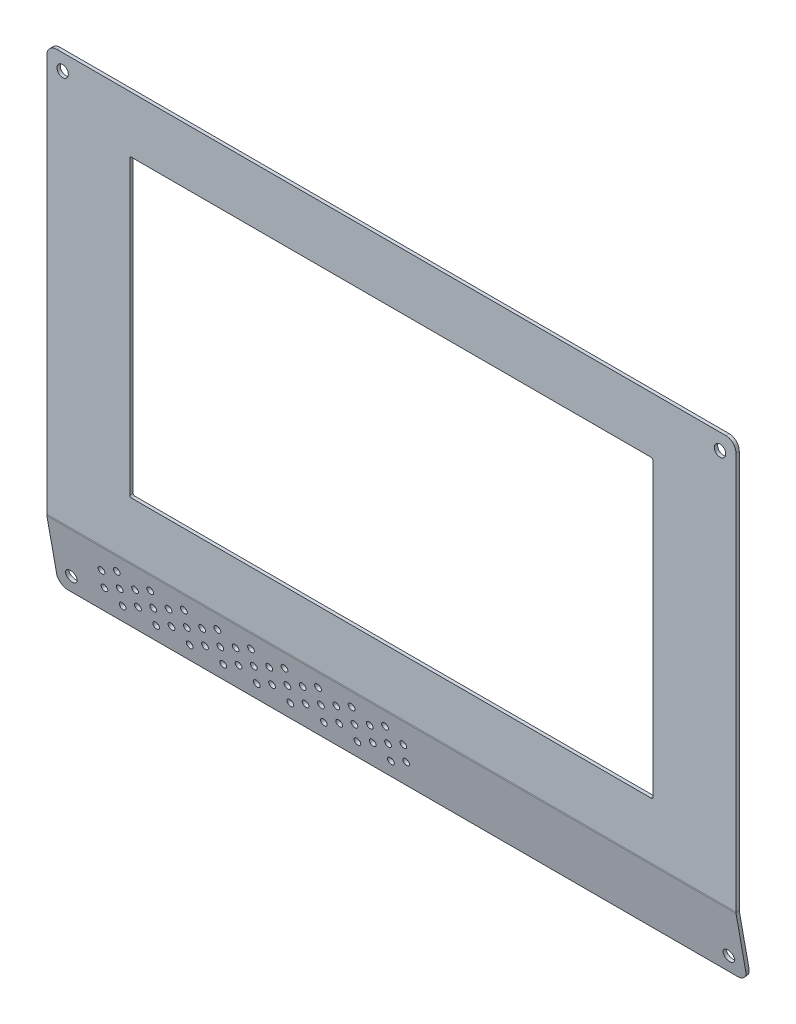
from build123d import *

# Parameters (mm, degrees)
SKETCH_2_W                      = 205.5
SKETCH_2_H                      = 121.5
SM_BASE_FLANGE_1_DEPTH          = 1
SM_EDGE_FLANGE_1_DEPTH          = 205.5
FILLET_1_R                      = 3
SKETCH_12_W                     = 156
SKETCH_12_H                     = 88
CUT_EXTRUDE_2_DEPTH             = 10
FILLET_2_R                      = 0.5
HOLE_WIZARD_M31_D               = 3.4
HOLE_WIZARD_M31_DEPTH           = 8.5
HOLE_WIZARD_M31_TIP             = 1.021463052
HOLE_WIZARD_M31_ON_FACE_2_D     = 3.4
HOLE_WIZARD_M31_ON_FACE_2_DEPTH = 8.5
HOLE_WIZARD_M31_ON_FACE_2_TIP   = 1.021463052
HOLE_WIZARD_M31_ON_FACE_3_D     = 3.4
HOLE_WIZARD_M31_ON_FACE_3_DEPTH = 8.5
HOLE_WIZARD_M31_ON_FACE_3_TIP   = 1.021463052
SKETCH_16_R                     = 1
CUT_EXTRUDE_3_DEPTH             = 10
PATTERN_LINEAR_1_COUNT          = 5
PATTERN_LINEAR_1_PITCH          = 10
PATTERN_LINEAR_1_COL_COUNT      = 5
PATTERN_LINEAR_1_COL_PITCH      = 10
SKETCH_17_R                     = 1
CUT_EXTRUDE_4_DEPTH             = 1
PATTERN_LINEAR_2_COUNT          = 6
PATTERN_LINEAR_2_PITCH          = 10
PATTERN_LINEAR_2_COL_COUNT      = 5
PATTERN_LINEAR_2_COL_PITCH      = 10


# Sheet-metal steps are written as plain solids
with BuildPart() as part:
    # Sketch 2 → Базовая кромка1 (new body)
    with BuildSketch(Plane.XY):
        Rectangle(SKETCH_2_W, SKETCH_2_H)
    extrude(amount=-SM_BASE_FLANGE_1_DEPTH)

    # Ребро-кромка1 section (across the edge) → Ребро-кромка1 (add)
    with BuildSketch(Plane(origin=(102.75, -60.889981862, -1), x_dir=(0, 0.1736481776669237, -0.9848077530122092), z_dir=(-1, 0, 0))):
        with BuildLine():
            Line((-1, 0.139981862), (-1, 19.912511336))
            Line((-1, 19.912511336), (0, 19.912511336))
            Line((0, 19.912511336), (0, 0.139981862))
            ThreePointArc((0, 0.139981862), (0.006088483, 0.000532673), (0.024307595, -0.137855223))
            Line((0.024307595, -0.137855223), (-0.960500158, -0.3115034))
            ThreePointArc((-0.960500158, -0.3115034), (-0.990106215, -0.08662307), (-1, 0.139981862))
        make_face()
    extrude(amount=SM_EDGE_FLANGE_1_DEPTH)

    # Скругление1
    fillet_1_edges = [part.edges().sort_by_distance(p)[0] for p in [
        (102.75, -80.586801497, -3.96536743),
        (-102.75, -80.586801497, -3.96536743),
        (-102.75, 60.75, -0.5),
        (102.75, 60.75, -0.5),
    ]]
    fillet(fillet_1_edges, radius=FILLET_1_R)

    # Эскиз12 → Вырез-Вытянуть2 (cut)
    with BuildSketch(Plane.XY):
        Rectangle(SKETCH_12_W, SKETCH_12_H)
    extrude(amount=-CUT_EXTRUDE_2_DEPTH, mode=Mode.SUBTRACT)

    # Скругление2
    fillet_2_edges = [part.edges().sort_by_distance(p)[0] for p in [
        (-78, -44, -0.5),
        (-78, 44, -0.5),
        (78, 44, -0.5),
        (78, -44, -0.5),
    ]]
    fillet(fillet_2_edges, radius=FILLET_2_R)

    # Сверло под метчик  спиральное M31
    with Locations(Plane(origin=(-98.021320344, -75.77058326, -2.608424904), x_dir=(0, 0.984807753012, 0.173648177667), z_dir=(0, -0.173648177667, 0.984807753012))):
        with Locations((0, 0)):
            Hole(HOLE_WIZARD_M31_D / 2, depth=HOLE_WIZARD_M31_DEPTH)
            with Locations((0, 0, -(HOLE_WIZARD_M31_DEPTH + HOLE_WIZARD_M31_TIP / 2))):  # 118° drill point
                Cone(0, HOLE_WIZARD_M31_D / 2, HOLE_WIZARD_M31_TIP, mode=Mode.SUBTRACT)

    # Сверло под метчик  спиральное M31 on face 2
    with Locations(Plane(origin=(98.021320344, -75.77058326, -2.608424904), x_dir=(0, 0.984807790843, 0.17364796312), z_dir=(0, -0.17364796312, 0.984807790843))):
        with Locations((0, 0)):
            Hole(HOLE_WIZARD_M31_ON_FACE_2_D / 2, depth=HOLE_WIZARD_M31_ON_FACE_2_DEPTH)
            with Locations((0, 0, -(HOLE_WIZARD_M31_ON_FACE_2_DEPTH + HOLE_WIZARD_M31_ON_FACE_2_TIP / 2))):  # 118° drill point
                Cone(0, HOLE_WIZARD_M31_ON_FACE_2_D / 2, HOLE_WIZARD_M31_ON_FACE_2_TIP, mode=Mode.SUBTRACT)

    # Сверло под метчик  спиральное M31 on face 3
    with Locations(Plane(origin=(-98.021320344, 55.994949149, 0), x_dir=(1, 0, 0), z_dir=(0, 0, 1))):
        with Locations((0, 0), (196.042640688, 0)):
            Hole(HOLE_WIZARD_M31_ON_FACE_3_D / 2, depth=HOLE_WIZARD_M31_ON_FACE_3_DEPTH)
            with Locations((0, 0, -(HOLE_WIZARD_M31_ON_FACE_3_DEPTH + HOLE_WIZARD_M31_ON_FACE_3_TIP / 2))):  # 118° drill point
                Cone(0, HOLE_WIZARD_M31_ON_FACE_3_D / 2, HOLE_WIZARD_M31_ON_FACE_3_TIP, mode=Mode.SUBTRACT)

    # Эскиз16 → Вырез-Вытянуть3 (cut)
    with BuildSketch(Plane(origin=(0, -1.838695719, 10.427761604), x_dir=(1, 0, 0), z_dir=(0, -0.17364817766692364, 0.9848077530122092))):
        with Locations(Location((-42.75, -70.164820995, 0), (0, 0, 270))):
            Circle(SKETCH_16_R)
        with Locations(Location((-42.75, -65.164820995, 0), (0, 0, 270))):
            Circle(SKETCH_16_R)
        with Locations(Location((-42.75, -75.164820995, 0), (0, 0, 270))):
            Circle(SKETCH_16_R)
    cut_extrude_3 = extrude(amount=-CUT_EXTRUDE_3_DEPTH, mode=Mode.SUBTRACT)

    # Линейный массив1: Вырез-Вытянуть3 ×5
    with Locations(*[(i * PATTERN_LINEAR_1_PITCH, 0, 0) for i in range(1, PATTERN_LINEAR_1_COUNT)]):
        add(cut_extrude_3, mode=Mode.SUBTRACT)

    # Линейный массив1 col: Вырез-Вытянуть3 ×5
    with Locations(*[(-i * PATTERN_LINEAR_1_COL_PITCH, 0, 0) for i in range(1, PATTERN_LINEAR_1_COL_COUNT)]):
        add(cut_extrude_3, mode=Mode.SUBTRACT)

    # Эскиз17 → Вырез-Вытянуть4 (cut)
    with BuildSketch(Plane(origin=(0, -1.838695719, 10.427761604), x_dir=(1, 0, 0), z_dir=(0, -0.17364817766692364, 0.9848077530122092))):
        with Locations(Location((-47.75, -67.664820995, 0), (0, 0, 270))):
            Circle(SKETCH_17_R)
        with Locations(Location((-47.75, -72.664820995, 0), (0, 0, 270))):
            Circle(SKETCH_17_R)
    cut_extrude_4 = extrude(amount=-CUT_EXTRUDE_4_DEPTH, mode=Mode.SUBTRACT)

    # Линейный массив2: Вырез-Вытянуть4 ×6
    with Locations(*[(i * PATTERN_LINEAR_2_PITCH, 0, 0) for i in range(1, PATTERN_LINEAR_2_COUNT)]):
        add(cut_extrude_4, mode=Mode.SUBTRACT)

    # Линейный массив2 col: Вырез-Вытянуть4 ×5
    with Locations(*[(-i * PATTERN_LINEAR_2_COL_PITCH, 0, 0) for i in range(1, PATTERN_LINEAR_2_COL_COUNT)]):
        add(cut_extrude_4, mode=Mode.SUBTRACT)


solid = part.part
